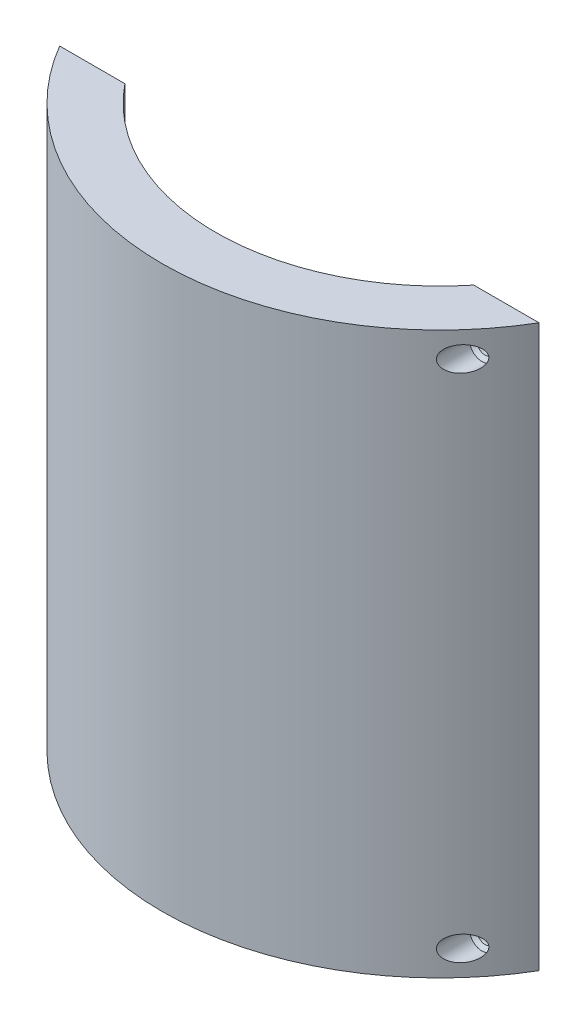
from build123d import *

# Parameters (mm, degrees)
BOSS_EXTRUDE1_DEPTH = 100


with BuildPart() as part:
    # Sketch1 → Boss-Extrude1 (new body)
    with BuildSketch(Plane(origin=(0, 0, 0), x_dir=(1, 0, 0), z_dir=(0, 1, 0))):
        with BuildLine():
            ThreePointArc((31.086694629, -25.07), (0, -39.936042405), (-31.086694629, -25.07))
            Line((-31.086694629, -25.07), (-42.716694629, -25.07))
            ThreePointArc((-42.716694629, -25.07), (0, -49.53), (42.716694629, -25.07))
            Line((42.716694629, -25.07), (31.086694629, -25.07))
        make_face()
    extrude(amount=BOSS_EXTRUDE1_DEPTH)

    # Sketch6 → Cut-Revolve4 (revolve, cut)
    with BuildSketch(Plane(origin=(36.901694629, 4.5125, 25.07), x_dir=(-1, 0, 0), z_dir=(0, -1, 0))):
        Polygon((0, 1.685394277), (0, -4.78184701), (0, -13.816548535), (-2.2, -13.816548535), (-2.2, -4.363650115), (-1.5, -3.78906096), (-1.5, 1.685394277), align=None)
    cut_revolve4 = revolve(axis=Axis((36.901694629, 4.5125, 23.384605723), (0, 0, 1)), mode=Mode.SUBTRACT)

    # Mirror1: Cut-Revolve4 across plane
    add(cut_revolve4.mirror(Plane(origin=(0, 50, 0), x_dir=(0, 0, 1), z_dir=(0, -1, 0))), mode=Mode.SUBTRACT)

    # Mirror1 at the second plane: Cut-Revolve4 across plane
    add(cut_revolve4.mirror(Plane(origin=(0, 0, 0), x_dir=(0, 0, 1), z_dir=(1, 0, 0))), mode=Mode.SUBTRACT)

    # Mirror1 at the second plane copy 1 sketc → Mirror1 at the second plane copy 1 (revolve, cut)
    with BuildSketch(Plane(origin=(-36.901694629, 95.4875, 25.07), x_dir=(1, 0, 0), z_dir=(0, 1, 0))):
        Polygon((0, 1.685394277), (0, -4.78184701), (0, -13.816548535), (-2.2, -13.816548535), (-2.2, -4.363650115), (-1.5, -3.78906096), (-1.5, 1.685394277), align=None)
    revolve(axis=Axis((-36.901694629, 95.4875, 23.384605723), (0, 0, 1)), mode=Mode.SUBTRACT)


solid = part.part
